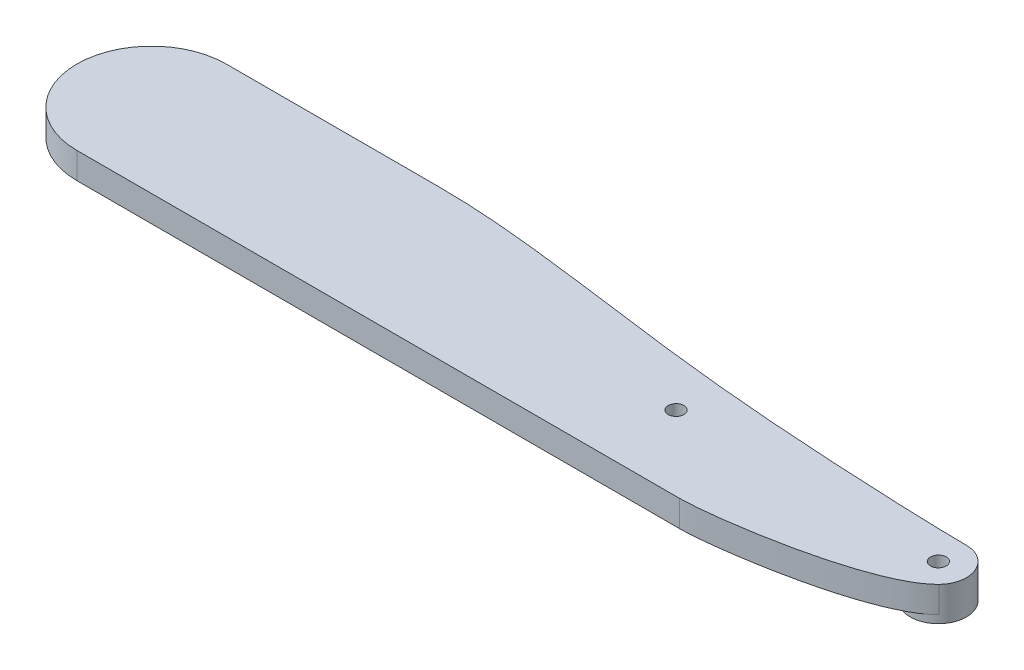
from build123d import *

# Parameters (mm, degrees)
BOSS_EXTRUDE1_DEPTH = 5
SKETCH4_R           = 1.5
CUT_EXTRUDE1_DEPTH  = 91.518644488
SKETCH6_R           = 5.35
BOSS_EXTRUDE2_DEPTH = 1.5
CUT_EXTRUDE2_REACH  = 92.614
SKETCH7_R           = 1.5
CUT_EXTRUDE3_START  = -5
CUT_EXTRUDE3_DEPTH  = 5


# Read off the part's stored shape, not the designer's step: Cut-Extrude3
with BuildPart() as part:
    # Sketch3 → Boss-Extrude1 (new body)
    with BuildSketch(Plane(origin=(0, 0, 0), x_dir=(1, 0, 0), z_dir=(0, 1, 0))):
        with BuildLine():
            Line((-75, 14.25), (75, 14.25))
            ThreePointArc((75, 14.25), (89.25, 0), (75, -14.25))
            Line((75, -14.25), (-75, -14.25))
            ThreePointArc((-75, -14.25), (-89.25, 0), (-75, 14.25))
        make_face()
    extrude(amount=BOSS_EXTRUDE1_DEPTH)

    # Sketch4 → Cut-Extrude1 (cut, through all)
    with BuildSketch(Plane(origin=(0, 5, 0), x_dir=(1, 0, 0), z_dir=(0, 1, 0))):
        with Locations(Location((25, 0, 0), (0, 0, 270))):
            Circle(SKETCH4_R)
        with Locations(Location((75, 0, 0), (0, 0, 270))):
            Circle(SKETCH4_R)
    extrude(amount=-CUT_EXTRUDE1_DEPTH, mode=Mode.SUBTRACT)

    # Sketch6 → Boss-Extrude2 (add)
    with BuildSketch(Plane.XZ):
        with Locations(Location((75, 0, 0), (0, 0, 90))):
            Circle(SKETCH6_R)
    extrude(amount=BOSS_EXTRUDE2_DEPTH)

    # Sketch7 → Cut-Extrude2 (cut, up to next)
    with BuildSketch(Plane.XZ.offset(1.5), mode=Mode.PRIVATE) as cut_extrude2_sk1:
        with Locations(Location((75, 0, 0), (0, 0, 90))):
            Circle(SKETCH7_R)
    cut_extrude2_tool1 = extrude(cut_extrude2_sk1.sketch, amount=-CUT_EXTRUDE2_REACH, mode=Mode.PRIVATE) & part.part
    add(cut_extrude2_tool1.solids().sort_by_distance((75, -1.5, 0))[0], mode=Mode.SUBTRACT)

    # Cut-Extrude3 outline → Cut-Extrude3 (cut)
    with BuildSketch(Plane.XZ.offset(CUT_EXTRUDE3_START)):
        with BuildLine():
            add(Edge.make_bspline(
                [(78.847956131, 3.716952194), (76.072393782, 6.590339205), (61.349969699, 12.082853178), (43.710632326, 14.25), (39.933768596, 14.25)],
                knots=[0, 0, 0, 0, 0.424659956, 1, 1, 1, 1], degree=3))
            ThreePointArc((78.847956131, 3.716952194), (79.924844883, -2.090072458), (75, -5.35))
            add(Edge.make_bspline(
                [(-34.598022438, -14.25), (-16.711424767, -14.25), (16.96977211, -7.115763951), (68.517114085, -5.35), (75, -5.35)],
                knots=[0, 0, 0, 0, 0.557363476, 1, 1, 1, 1], degree=3))
            Line((-34.598022438, -14.25), (75, -14.25))
            ThreePointArc((75, -14.25), (89.25, 0), (75, 14.25))
            Line((75, 14.25), (39.933768596, 14.25))
        make_face()
    extrude(amount=CUT_EXTRUDE3_DEPTH, mode=Mode.SUBTRACT)


solid = part.part
